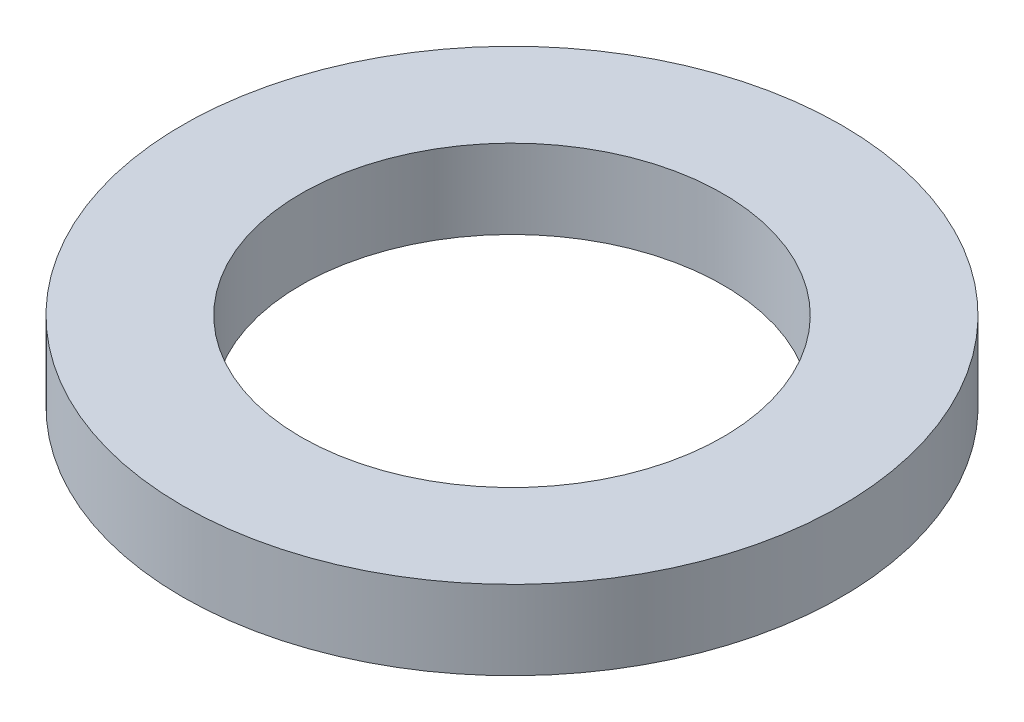
from build123d import *

# Parameters (mm, degrees)
SKETCH1_R           = 62.5
BOSS_EXTRUDE1_DEPTH = 15
SKETCH2_R           = 40
CUT_EXTRUDE1_DEPTH  = 90.652105385


with BuildPart() as part:
    # Sketch1 → Boss-Extrude1 (new body)
    with BuildSketch(Plane(origin=(0, 0, 0), x_dir=(1, 0, 0), z_dir=(0, 1, 0))):
        Circle(SKETCH1_R)
    extrude(amount=BOSS_EXTRUDE1_DEPTH)

    # Sketch2 → Cut-Extrude1 (cut, through all)
    with BuildSketch(Plane(origin=(0, 0, 0), x_dir=(1, 0, 0), z_dir=(0, 1, 0))):
        Circle(SKETCH2_R)
    extrude(amount=CUT_EXTRUDE1_DEPTH, mode=Mode.SUBTRACT)


solid = part.part
